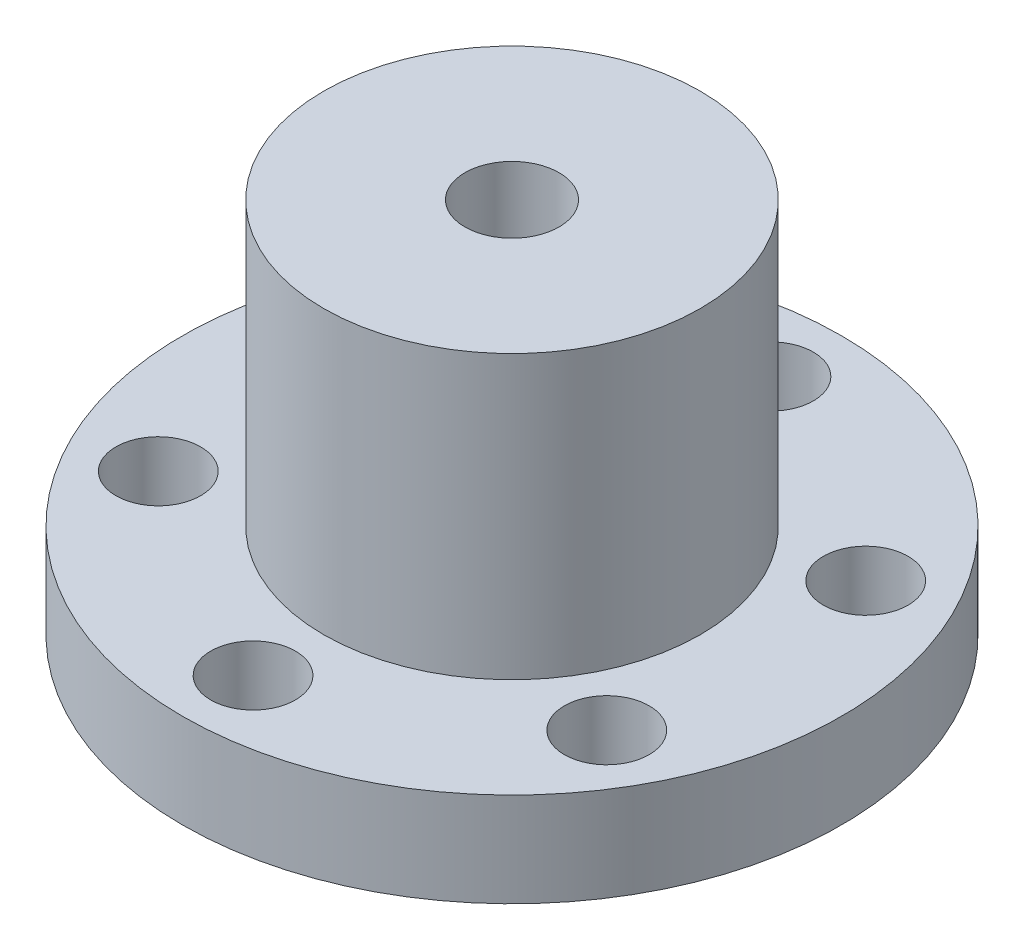
from build123d import *

# Parameters (mm, degrees)
SKETCH2_R           = 17.5
SKETCH2_R_2         = 2.25
BOSS_EXTRUDE1_DEPTH = 5
SKETCH3_R           = 10
BOSS_EXTRUDE2_DEPTH = 15
SKETCH4_R           = 2.5
CUT_EXTRUDE1_DEPTH  = 32.819805153


with BuildPart() as part:
    # Sketch2 → Boss-Extrude1 (new body)
    with BuildSketch(Plane(origin=(0, 0, 0), x_dir=(1, 0, 0), z_dir=(0, 1, 0))):
        Circle(SKETCH2_R)
        with Locations((0, 13.75)):
            Circle(SKETCH2_R_2, mode=Mode.SUBTRACT)
        with Locations((11.907849302, 6.875)):
            Circle(SKETCH2_R_2, mode=Mode.SUBTRACT)
        with Locations((11.907849302, -6.875)):
            Circle(SKETCH2_R_2, mode=Mode.SUBTRACT)
        with Locations((0, -13.75)):
            Circle(SKETCH2_R_2, mode=Mode.SUBTRACT)
        with Locations((-11.907849302, -6.875)):
            Circle(SKETCH2_R_2, mode=Mode.SUBTRACT)
        with Locations((-11.907849302, 6.875)):
            Circle(SKETCH2_R_2, mode=Mode.SUBTRACT)
    extrude(amount=BOSS_EXTRUDE1_DEPTH)

    # Sketch3 → Boss-Extrude2 (add)
    with BuildSketch(Plane(origin=(0, 5, 0), x_dir=(1, 0, 0), z_dir=(0, 1, 0))):
        Circle(SKETCH3_R)
    extrude(amount=BOSS_EXTRUDE2_DEPTH)

    # Sketch4 → Cut-Extrude1 (cut, through all)
    with BuildSketch(Plane(origin=(0, 20, 0), x_dir=(1, 0, 0), z_dir=(0, 1, 0))):
        Circle(SKETCH4_R)
    extrude(amount=-CUT_EXTRUDE1_DEPTH, mode=Mode.SUBTRACT)


solid = part.part
